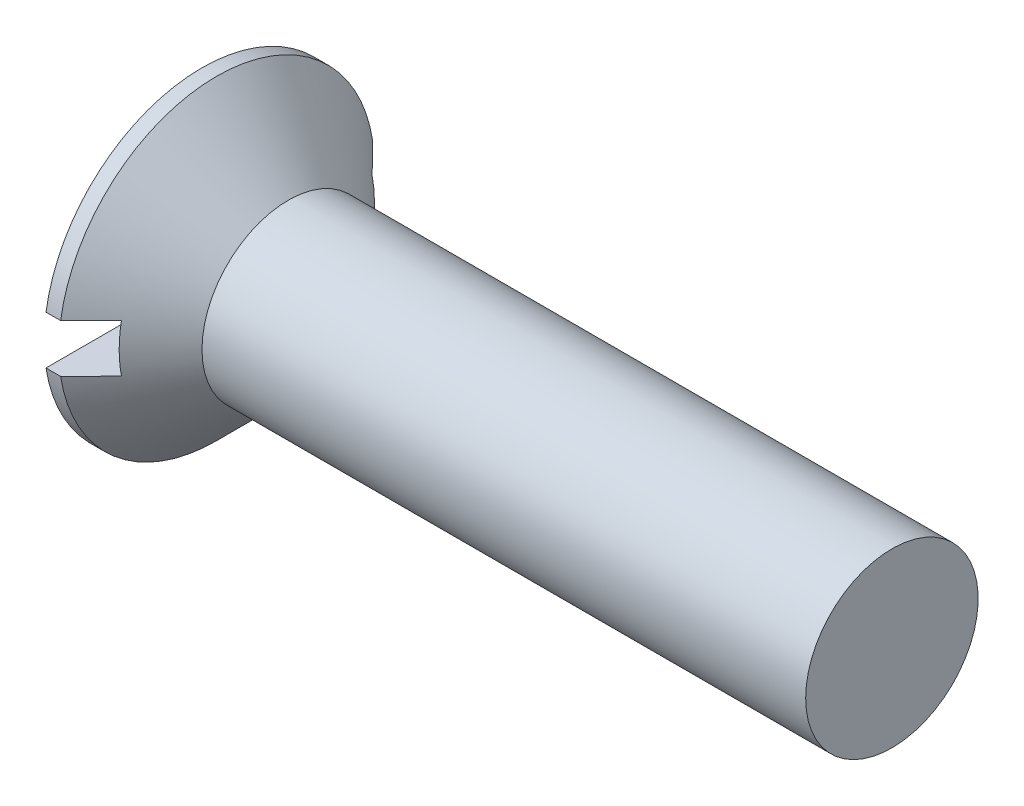
from build123d import *

# Parameters (mm, degrees)
SKETCH2_W         = 18.3
SKETCH2_H         = 2.8
SLOT_DEPTH        = 2.6
CIRPATTERN1_COUNT = 2
CIRPATTERN1_ANGLE = 90


with BuildPart() as part:
    # BodySke → Base-Revolve (revolve)
    with BuildSketch(Plane.XY):
        Polygon((0, 0), (0, 9.15), (0.85, 9.15), (5, 5), (40, 5), (40, 0), align=None)
    revolve(axis=Axis((-6.35, 0, 0), (1, 0, 0)))

    # Sketch2 → Slot (cut)
    with BuildSketch(Plane.ZY):
        Rectangle(SKETCH2_W, SKETCH2_H)
    extrude(amount=-SLOT_DEPTH, mode=Mode.SUBTRACT)

    # Sketch3 → Cross section 0
    with BuildSketch(Plane.ZY):
        with BuildLine():
            Line((-0.99, 4.94), (0.99, 4.94))
            Line((0.99, 4.94), (0.99, -4.94))
            Line((0.99, -4.94), (-0.99, -4.94))
            Line((-0.99, -4.94), (-0.99, 4.94))
        make_face()
    # Sketch4 → Cross section 1
    with BuildSketch(Plane.ZY.offset(-5.98)):
        with BuildLine():
            Line((-0.495, 0.495), (0.495, 0.495))
            Line((0.495, 0.495), (0.495, -0.495))
            Line((0.495, -0.495), (-0.495, -0.495))
            Line((-0.495, -0.495), (-0.495, 0.495))
        make_face()
    cross = loft(mode=Mode.SUBTRACT)

    # CirPattern1: Cross ×2 about axis
    cirpattern1_axis = Axis((-6.35, 0, 0), (1, 0, 0))
    for i in range(1, CIRPATTERN1_COUNT):
        add(cross.rotate(cirpattern1_axis, i * CIRPATTERN1_ANGLE / (CIRPATTERN1_COUNT - 1)), mode=Mode.SUBTRACT)


solid = part.part
